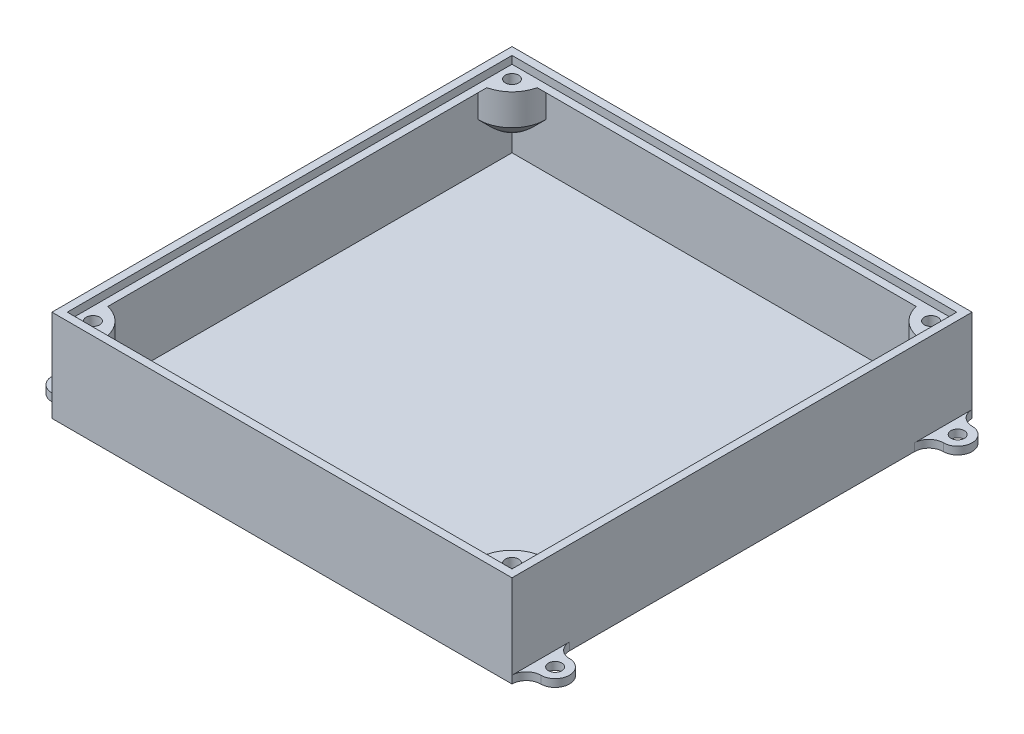
from build123d import *

# Parameters (mm, degrees)
SKETCH1_W                       = 120
SKETCH1_H                       = 120
SKETCH1_W_2                     = 116
SKETCH1_H_2                     = 116
BOSS_EXTRUDE1_DEPTH             = 2
SKETCH1_3_W                     = 120
SKETCH1_3_H                     = 120
SKETCH1_3_W_2                   = 116
SKETCH1_3_H_2                   = 116
BOSS_EXTRUDE2_DEPTH             = 20
BOSS_EXTRUDE4_DEPTH             = 20
SKETCH16_R                      = 1.75
CUT_EXTRUDE8_DEPTH              = 3
CUT_EXTRUDE9_DEPTH              = 3
BOSS_EXTRUDE5_DEPTH             = 0.3
SKETCH18_R                      = 1.75
CUT_EXTRUDE10_DEPTH             = 3
CUT_REVOLVE5_DEPTH              = 5.739847272
CUT_REVOLVE5_START              = 1.8876
CUT_REVOLVE5_2_DEPTH            = 18.1124
CUT_REVOLVE5_3_ANGLE            = 90
SKETCH21_W                      = 120
SKETCH21_H                      = 120
SKETCH21_W_2                    = 116
SKETCH21_H_2                    = 116
BOSS_EXTRUDE6_DEPTH             = 2
BOSS_EXTRUDE7_REACH             = 89.658
BOSS_EXTRUDE7_DIRECTION_2_REACH = 89.658
BOSS_EXTRUDE8_REACH             = 89.658
BOSS_EXTRUDE8_DIRECTION_2_REACH = 89.658
SKETCH25_R                      = 3.75
SKETCH25_R_2                    = 1.75
BOSS_EXTRUDE10_DEPTH            = 2


with BuildPart() as part:
    # Sketch1 → Boss-Extrude1 (new body)
    # profile 1 of 2: a face of its own
    with BuildSketch(Plane(origin=(0, 0, 0), x_dir=(1, 0, 0), z_dir=(0, 1, 0))):
        Rectangle(SKETCH1_W, SKETCH1_H)
        Rectangle(SKETCH1_W_2, SKETCH1_H_2, mode=Mode.SUBTRACT)
    # profile 2 of 2: a face of its own
    with BuildSketch(Plane(origin=(0, 0, 0), x_dir=(1, 0, 0), z_dir=(0, 1, 0))):
        Rectangle(SKETCH1_W_2, SKETCH1_H_2)
    extrude(amount=-BOSS_EXTRUDE1_DEPTH)

    # Sketch1<3> → Boss-Extrude2 (add)
    with BuildSketch(Plane(origin=(0, 0, 0), x_dir=(1, 0, 0), z_dir=(0, 1, 0))):
        Rectangle(SKETCH1_3_W, SKETCH1_3_H)
        Rectangle(SKETCH1_3_W_2, SKETCH1_3_H_2, mode=Mode.SUBTRACT)
    extrude(amount=BOSS_EXTRUDE2_DEPTH)


with BuildPart() as body_2:
    # Sketch15 → Boss-Extrude4 (new body)
    with BuildSketch(Plane(origin=(0, 20, 0), x_dir=(1, 0, 0), z_dir=(0, 1, 0))):
        with BuildLine():
            Line((-50.334183167, 58), (-49.18983317, 58))
            Line((-49.18983317, 58), (-49.18983317, 60))
            Line((-49.18983317, 60), (-53.524336105, 60))
            ThreePointArc((-53.524336105, 60), (-51.751547032, 59.283465193), (-50.334183167, 58))
        make_face()
        with BuildLine():
            ThreePointArc((-60, 53.524336105), (-59.283465193, 51.751547032), (-58, 50.334183167))
            Line((-58, 50.334183167), (-58, 58))
            Line((-58, 58), (-50.334183167, 58))
            ThreePointArc((-50.334183167, 58), (-51.751547032, 59.283465193), (-53.524336105, 60))
            Line((-53.524336105, 60), (-55.783533465, 60))
            ThreePointArc((-55.783533465, 60), (-58.51763809, 58.51763809), (-60, 55.783533465))
            Line((-60, 55.783533465), (-60, 53.524336105))
        make_face()
        with BuildLine():
            Line((-60, 60), (-60, 55.783533465))
            ThreePointArc((-60, 55.783533465), (-58.51763809, 58.51763809), (-55.783533465, 60))
            Line((-55.783533465, 60), (-60, 60))
        make_face()
        with BuildLine():
            Line((-60, 49.18983317), (-58, 49.18983317))
            Line((-58, 49.18983317), (-58, 50.334183167))
            ThreePointArc((-58, 50.334183167), (-59.283465193, 51.751547032), (-60, 53.524336105))
            Line((-60, 53.524336105), (-60, 49.18983317))
        make_face()
        with BuildLine():
            Line((-58, 49.18983317), (-54.653934785, 49.18983317))
            ThreePointArc((-54.653934785, 49.18983317), (-56.422103989, 49.483829938), (-58, 50.334183167))
            Line((-58, 50.334183167), (-58, 49.18983317))
        make_face()
        with BuildLine():
            ThreePointArc((-58, 50.334183167), (-56.422103989, 49.483829938), (-54.653934785, 49.18983317))
            ThreePointArc((-54.653934785, 49.18983317), (-50.79023148, 50.79023148), (-49.18983317, 54.653934785))
            ThreePointArc((-49.18983317, 54.653934785), (-49.483829938, 56.422103989), (-50.334183167, 58))
            Line((-50.334183167, 58), (-58, 58))
            Line((-58, 58), (-58, 50.334183167))
        make_face()
        with BuildLine():
            ThreePointArc((-50.334183167, 58), (-49.483829938, 56.422103989), (-49.18983317, 54.653934785))
            Line((-49.18983317, 54.653934785), (-49.18983317, 58))
            Line((-49.18983317, 58), (-50.334183167, 58))
        make_face()
    extrude(amount=-BOSS_EXTRUDE4_DEPTH)

    # Sketch16 → Cut-Extrude8 (cut)
    with BuildSketch(Plane(origin=(0, 20, 0), x_dir=(1, 0, 0), z_dir=(0, 1, 0))):
        with Locations(Location((-54.653934785, 54.653934785, 0), (0, 0, 270))):
            Circle(SKETCH16_R)
    extrude(amount=-CUT_EXTRUDE8_DEPTH, mode=Mode.SUBTRACT)

    # Sketch17 → Cut-Extrude9 (cut)
    with BuildSketch(Plane(origin=(0, 17, 0), x_dir=(1, 0, 0), z_dir=(0, 1, 0))):
        Polygon((-55.550510257, 51.30786957), (-52.204445042, 52.204445042), (-51.30786957, 55.550510257), (-53.757359313, 58), (-57.103424528, 57.103424528), (-58, 53.757359313), align=None)
    extrude(amount=-CUT_EXTRUDE9_DEPTH, mode=Mode.SUBTRACT)

    # Sketch17<2> → Boss-Extrude5 (add)
    with BuildSketch(Plane(origin=(0, 17, 0), x_dir=(1, 0, 0), z_dir=(0, 1, 0))):
        Polygon((-55.550510257, 51.30786957), (-52.204445042, 52.204445042), (-51.30786957, 55.550510257), (-53.757359313, 58), (-57.103424528, 57.103424528), (-58, 53.757359313), align=None)
    extrude(amount=BOSS_EXTRUDE5_DEPTH)

    # Sketch18 → Cut-Extrude10 (cut)
    with BuildSketch(Plane(origin=(0, 14, 0), x_dir=(1, 0, 0), z_dir=(0, 1, 0))):
        with Locations(Location((-54.653934785, 54.653934785, 0), (0, 0, 270))):
            Circle(SKETCH18_R)
    extrude(amount=-CUT_EXTRUDE10_DEPTH, mode=Mode.SUBTRACT)

    # Cut-Revolve5: read off the stored shape, not the designer's step
    # Cut-Revolve5 outline → Cut-Revolve5 (cut)
    with BuildSketch(Plane(origin=(0, 0, 0), x_dir=(1, 0, 0), z_dir=(0, 1, 0))):
        with BuildLine():
            Line((-49.18983317, 58), (-58, 58))
            Line((-58, 58), (-58, 49.18983317))
            Line((-58, 49.18983317), (-54.653934785, 49.18983317))
            ThreePointArc((-54.653934785, 49.18983317), (-50.79023148, 50.79023148), (-49.18983317, 54.653934785))
            Line((-49.18983317, 54.653934785), (-49.18983317, 58))
        make_face()
    extrude(amount=CUT_REVOLVE5_DEPTH, mode=Mode.SUBTRACT)

    # Cut-Revolve5 2 outline → Cut-Revolve5 2 (cut)
    with BuildSketch(Plane(origin=(0, 0, 0), x_dir=(1, 0, 0), z_dir=(0, 1, 0)).offset(CUT_REVOLVE5_START)):
        with BuildLine():
            ThreePointArc((-49.18983317, 58), (-51.770271291, 51.770271291), (-58, 49.18983317))
            Line((-58, 49.18983317), (-54.653934785, 49.18983317))
            ThreePointArc((-54.653934785, 49.18983317), (-50.79023148, 50.79023148), (-49.18983317, 54.653934785))
            Line((-49.18983317, 54.653934785), (-49.18983317, 58))
        make_face()
    extrude(amount=CUT_REVOLVE5_2_DEPTH, mode=Mode.SUBTRACT)

    # Cut-Revolve5 3 outline → Cut-Revolve5 3 (revolve, cut)
    with BuildSketch(Plane(origin=(-58, 0, -58), x_dir=(0, 0, 1), z_dir=(-1, 0, 0))):
        with BuildLine():
            add(Edge.make_bspline(
                [(0, 5.739847272), (3.282261739, 6.357769399), (5.643942271, 8.719449932)],
                knots=[4.898472057, 4.898472057, 4.898472057, 5.497787144, 5.497787144, 5.497787144], degree=2, weights=[1, 0.955437636, 1]))
            Line((0, 5.739847272), (8.81016683, 5.739847272))
            Line((8.81016683, 5.739847272), (8.81016683, 11.88567449))
            Line((8.81016683, 11.88567449), (5.643942271, 8.719449932))
        make_face()
    revolve(axis=Axis((-58, 0, -58), (0, 1, 0)), revolution_arc=CUT_REVOLVE5_3_ANGLE, mode=Mode.SUBTRACT)


with BuildPart() as body_3:
    # Mirror1: mirrored copy
    add(body_2.part.mirror(Plane.XY))


with BuildPart() as body_4:
    # Mirror2: mirrored copy
    add(body_2.part.mirror(Plane(origin=(0, 0, 0), x_dir=(0, 0, 1), z_dir=(1, 0, 0))))


with BuildPart() as body_5:
    # Mirror2 2: mirrored copy
    add(body_3.part.mirror(Plane(origin=(0, 0, 0), x_dir=(0, 0, 1), z_dir=(1, 0, 0))))


with BuildPart() as part_1:
    add(part.part)

    # Combine1: union body 2, body 3, body 5, body 4
    add(body_2.part)
    add(body_3.part)
    add(body_5.part)
    add(body_4.part)

    # Sketch21 → Boss-Extrude6 (add)
    with BuildSketch(Plane(origin=(0, 20, 0), x_dir=(1, 0, 0), z_dir=(0, 1, 0))):
        Rectangle(SKETCH21_W, SKETCH21_H)
        Rectangle(SKETCH21_W_2, SKETCH21_H_2, mode=Mode.SUBTRACT)
    extrude(amount=BOSS_EXTRUDE6_DEPTH)

    # Sketch23 → Boss-Extrude7 (add, up to next)
    with BuildSketch(Plane.XY, mode=Mode.PRIVATE) as boss_extrude7_sk1:
        Polygon((-58, 20), (-56, 20), (-58, 18), align=None)
    boss_extrude7_tool1 = extrude(boss_extrude7_sk1.sketch, amount=BOSS_EXTRUDE7_REACH, mode=Mode.PRIVATE) - part_1.part
    # Sketch23 → Boss-Extrude7 (add, up to next)
    with BuildSketch(Plane.XY, mode=Mode.PRIVATE) as boss_extrude7_sk2:
        Polygon((58, 18), (58, 20), (56, 20), align=None)
    boss_extrude7_tool2 = extrude(boss_extrude7_sk2.sketch, amount=BOSS_EXTRUDE7_REACH, mode=Mode.PRIVATE) - part_1.part
    add(boss_extrude7_tool1.solids().sort_by_distance((-57.333333, 19.333333, 0))[0])
    add(boss_extrude7_tool2.solids().sort_by_distance((57.333333, 19.333333, 0))[0])

    # Sketch23 → Boss-Extrude7 direction 2 (add, up to next)
    with BuildSketch(Plane.XY, mode=Mode.PRIVATE) as boss_extrude7_direction_2_sk1:
        Polygon((-58, 20), (-56, 20), (-58, 18), align=None)
    boss_extrude7_direction_2_tool1 = extrude(boss_extrude7_direction_2_sk1.sketch, amount=-BOSS_EXTRUDE7_DIRECTION_2_REACH, mode=Mode.PRIVATE) - part_1.part
    # Sketch23 → Boss-Extrude7 direction 2 (add, up to next)
    with BuildSketch(Plane.XY, mode=Mode.PRIVATE) as boss_extrude7_direction_2_sk2:
        Polygon((58, 18), (58, 20), (56, 20), align=None)
    boss_extrude7_direction_2_tool2 = extrude(boss_extrude7_direction_2_sk2.sketch, amount=-BOSS_EXTRUDE7_DIRECTION_2_REACH, mode=Mode.PRIVATE) - part_1.part
    add(boss_extrude7_direction_2_tool1.solids().sort_by_distance((-57.333333, 19.333333, 0))[0])
    add(boss_extrude7_direction_2_tool2.solids().sort_by_distance((57.333333, 19.333333, 0))[0])

    # Sketch24 → Boss-Extrude8 (add, up to next)
    with BuildSketch(Plane(origin=(0, 0, 0), x_dir=(0, 0, -1), z_dir=(1, 0, 0)), mode=Mode.PRIVATE) as boss_extrude8_sk1:
        Polygon((58, 20), (58, 18), (56, 20), align=None)
    boss_extrude8_tool1 = extrude(boss_extrude8_sk1.sketch, amount=BOSS_EXTRUDE8_REACH, mode=Mode.PRIVATE) - part_1.part
    # Sketch24 → Boss-Extrude8 (add, up to next)
    with BuildSketch(Plane(origin=(0, 0, 0), x_dir=(0, 0, -1), z_dir=(1, 0, 0)), mode=Mode.PRIVATE) as boss_extrude8_sk2:
        Polygon((-56, 20), (-58, 20), (-58, 18), align=None)
    boss_extrude8_tool2 = extrude(boss_extrude8_sk2.sketch, amount=BOSS_EXTRUDE8_REACH, mode=Mode.PRIVATE) - part_1.part
    add(boss_extrude8_tool1.solids().sort_by_distance((0, 19.333333, -57.333333))[0])
    add(boss_extrude8_tool2.solids().sort_by_distance((0, 19.333333, 57.333333))[0])

    # Sketch24 → Boss-Extrude8 direction 2 (add, up to next)
    with BuildSketch(Plane(origin=(0, 0, 0), x_dir=(0, 0, -1), z_dir=(1, 0, 0)), mode=Mode.PRIVATE) as boss_extrude8_direction_2_sk1:
        Polygon((58, 20), (58, 18), (56, 20), align=None)
    boss_extrude8_direction_2_tool1 = extrude(boss_extrude8_direction_2_sk1.sketch, amount=-BOSS_EXTRUDE8_DIRECTION_2_REACH, mode=Mode.PRIVATE) - part_1.part
    # Sketch24 → Boss-Extrude8 direction 2 (add, up to next)
    with BuildSketch(Plane(origin=(0, 0, 0), x_dir=(0, 0, -1), z_dir=(1, 0, 0)), mode=Mode.PRIVATE) as boss_extrude8_direction_2_sk2:
        Polygon((-56, 20), (-58, 20), (-58, 18), align=None)
    boss_extrude8_direction_2_tool2 = extrude(boss_extrude8_direction_2_sk2.sketch, amount=-BOSS_EXTRUDE8_DIRECTION_2_REACH, mode=Mode.PRIVATE) - part_1.part
    add(boss_extrude8_direction_2_tool1.solids().sort_by_distance((0, 19.333333, -57.333333))[0])
    add(boss_extrude8_direction_2_tool2.solids().sort_by_distance((0, 19.333333, 57.333333))[0])

    # Sketch25 → Boss-Extrude10 (add)
    # profile 1 of 20: a face of its own
    with BuildSketch(Plane.XZ.offset(2)):
        with BuildLine():
            Line((60, 60), (60, 56.25))
            Line((60, 56.25), (63.75, 56.25))
            ThreePointArc((63.75, 56.25), (61.098349571, 57.348349571), (60, 60))
        make_face()
    # profile 2 of 20: a face of its own
    with BuildSketch(Plane.XZ.offset(2)):
        with BuildLine():
            Line((60, 56.25), (60, 52.5))
            ThreePointArc((60, 52.5), (61.098349571, 55.151650429), (63.75, 56.25))
            Line((63.75, 56.25), (60, 56.25))
        make_face()
    # profile 3 of 20: a face of its own
    with BuildSketch(Plane.XZ.offset(2)):
        with Locations((63.75, 52.5)):
            Circle(SKETCH25_R)
        with Locations(Location((63.75, 52.5, 0), (0, 0, 270))):
            Circle(SKETCH25_R_2, mode=Mode.SUBTRACT)
    # profile 4 of 20: a face of its own
    with BuildSketch(Plane.XZ.offset(2)):
        with BuildLine():
            Line((60, 52.5), (60, 48.75))
            Line((60, 48.75), (63.75, 48.75))
            ThreePointArc((63.75, 48.75), (61.098349571, 49.848349571), (60, 52.5))
        make_face()
    # profile 5 of 20: a face of its own
    with BuildSketch(Plane.XZ.offset(2)):
        with BuildLine():
            Line((60, 48.75), (60, 45))
            ThreePointArc((60, 45), (61.098349571, 47.651650429), (63.75, 48.75))
            Line((63.75, 48.75), (60, 48.75))
        make_face()
    # profile 6 of 20: a face of its own
    with BuildSketch(Plane.XZ.offset(2)):
        with BuildLine():
            ThreePointArc((63.75, -48.75), (61.098349571, -47.651650429), (60, -45))
            Line((60, -45), (60, -48.75))
            Line((60, -48.75), (63.75, -48.75))
        make_face()
    # profile 7 of 20: a face of its own
    with BuildSketch(Plane.XZ.offset(2)):
        with BuildLine():
            Line((63.75, -48.75), (60, -48.75))
            Line((60, -48.75), (60, -52.5))
            ThreePointArc((60, -52.5), (61.098349571, -49.848349571), (63.75, -48.75))
        make_face()
    # profile 8 of 20: a face of its own
    with BuildSketch(Plane.XZ.offset(2)):
        with Locations((63.75, -52.5)):
            Circle(SKETCH25_R)
        with Locations(Location((63.75, -52.5, 0), (0, 0, 270))):
            Circle(SKETCH25_R_2, mode=Mode.SUBTRACT)
    # profile 9 of 20: a face of its own
    with BuildSketch(Plane.XZ.offset(2)):
        with BuildLine():
            ThreePointArc((63.75, -56.25), (61.098349571, -55.151650429), (60, -52.5))
            Line((60, -52.5), (60, -56.25))
            Line((60, -56.25), (63.75, -56.25))
        make_face()
    # profile 10 of 20: a face of its own
    with BuildSketch(Plane.XZ.offset(2)):
        with BuildLine():
            Line((63.75, -56.25), (60, -56.25))
            Line((60, -56.25), (60, -60))
            ThreePointArc((60, -60), (61.098349571, -57.348349571), (63.75, -56.25))
        make_face()
    # profile 11 of 20: a face of its own
    with BuildSketch(Plane.XZ.offset(2)):
        with BuildLine():
            Line((-60, -48.75), (-60, -45))
            ThreePointArc((-60, -45), (-61.098349571, -47.651650429), (-63.75, -48.75))
            Line((-63.75, -48.75), (-60, -48.75))
        make_face()
    # profile 12 of 20: a face of its own
    with BuildSketch(Plane.XZ.offset(2)):
        with BuildLine():
            Line((-60, -52.5), (-60, -48.75))
            Line((-60, -48.75), (-63.75, -48.75))
            ThreePointArc((-63.75, -48.75), (-61.098349571, -49.848349571), (-60, -52.5))
        make_face()
    # profile 13 of 20: a face of its own
    with BuildSketch(Plane.XZ.offset(2)):
        with BuildLine():
            Line((-60, -56.25), (-60, -52.5))
            ThreePointArc((-60, -52.5), (-61.098349571, -55.151650429), (-63.75, -56.25))
            Line((-63.75, -56.25), (-60, -56.25))
        make_face()
    # profile 14 of 20: a face of its own
    with BuildSketch(Plane.XZ.offset(2)):
        with BuildLine():
            Line((-60, -56.25), (-63.75, -56.25))
            ThreePointArc((-63.75, -56.25), (-61.098349571, -57.348349571), (-60, -60))
            Line((-60, -60), (-60, -56.25))
        make_face()
    # profile 15 of 20: a face of its own
    with BuildSketch(Plane.XZ.offset(2)):
        with Locations((-63.75, -52.5)):
            Circle(SKETCH25_R)
        with Locations(Location((-63.75, -52.5, 0), (0, 0, 270))):
            Circle(SKETCH25_R_2, mode=Mode.SUBTRACT)
    # profile 16 of 20: a face of its own
    with BuildSketch(Plane.XZ.offset(2)):
        with BuildLine():
            Line((-63.75, 56.25), (-60, 56.25))
            Line((-60, 56.25), (-60, 60))
            ThreePointArc((-60, 60), (-61.098349571, 57.348349571), (-63.75, 56.25))
        make_face()
    # profile 17 of 20: a face of its own
    with BuildSketch(Plane.XZ.offset(2)):
        with BuildLine():
            Line((-60, 52.5), (-60, 56.25))
            Line((-60, 56.25), (-63.75, 56.25))
            ThreePointArc((-63.75, 56.25), (-61.098349571, 55.151650429), (-60, 52.5))
        make_face()
    # profile 18 of 20: a face of its own
    with BuildSketch(Plane.XZ.offset(2)):
        with Locations((-63.75, 52.5)):
            Circle(SKETCH25_R)
        with Locations(Location((-63.75, 52.5, 0), (0, 0, 270))):
            Circle(SKETCH25_R_2, mode=Mode.SUBTRACT)
    # profile 19 of 20: a face of its own
    with BuildSketch(Plane.XZ.offset(2)):
        with BuildLine():
            Line((-60, 48.75), (-60, 52.5))
            ThreePointArc((-60, 52.5), (-61.098349571, 49.848349571), (-63.75, 48.75))
            Line((-63.75, 48.75), (-60, 48.75))
        make_face()
    # profile 20 of 20: a face of its own
    with BuildSketch(Plane.XZ.offset(2)):
        with BuildLine():
            Line((-60, 48.75), (-63.75, 48.75))
            ThreePointArc((-63.75, 48.75), (-61.098349571, 47.651650429), (-60, 45))
            Line((-60, 45), (-60, 48.75))
        make_face()
    extrude(amount=-BOSS_EXTRUDE10_DEPTH)


solid = part_1.part
